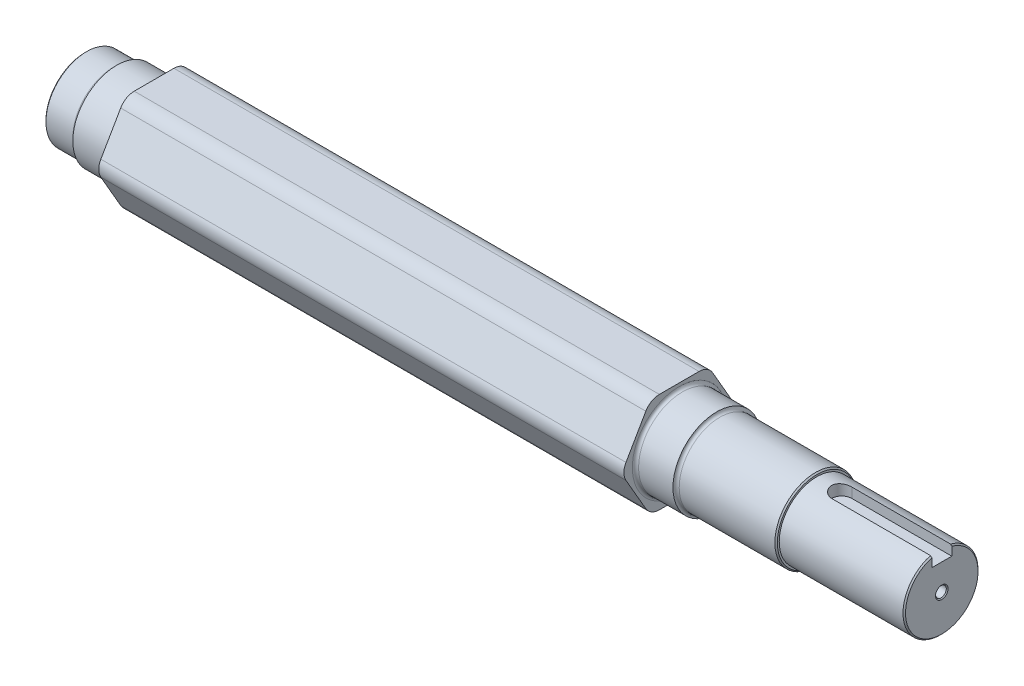
from build123d import *

# Parameters (mm, degrees)
BOSS_EXTRUDE3_DEPTH                    = 210
FILLET1_R                              = 2.5
FILLET2_R                              = 12.5
CHAMFER1_SIZE                          = 1
M10_TAPPED_HOLE1_D                     = 8.5
M10_TAPPED_HOLE1_DEPTH                 = 27.5
M10_TAPPED_HOLE1_CSINK_D               = 10.05
M10_TAPPED_HOLE1_CSINK_ANGLE           = 100
M10_TAPPED_HOLE1_TIP                   = 2.553657631
M10_TAPPED_HOLE1_ON_FACE_2_D           = 8.5
M10_TAPPED_HOLE1_ON_FACE_2_DEPTH       = 27.5
M10_TAPPED_HOLE1_ON_FACE_2_CSINK_D     = 10.05
M10_TAPPED_HOLE1_ON_FACE_2_CSINK_ANGLE = 100
M10_TAPPED_HOLE1_ON_FACE_2_TIP         = 2.553657631
CUT_EXTRUDE1_DEPTH                     = 9


with BuildPart() as part:
    # Sketch1 → Boss-Extrude3 (new, symmetric)
    with BuildSketch(Plane(origin=(0, 0, 0), x_dir=(0, 0, -1), z_dir=(1, 0, 0))):
        Polygon((23.094010768, -40), (46.188021535, 0), (23.094010768, 40), (-23.094010768, 40), (-46.188021535, 0), (-23.094010768, -40), align=None)
    extrude(amount=BOSS_EXTRUDE3_DEPTH, both=True)

    # Sketch3 → Revolve1 (revolve)
    with BuildSketch(Plane.XY, mode=Mode.PRIVATE) as revolve1_sk:
        Polygon((-210, 35), (-240, 35), (-240, 32.5), (-265, 32.5), (-265, 0), (-210, 0), align=None)
        Polygon((210, 35), (240, 35), (240, 32.5), (320, 32.5), (320, 30), (420, 30), (420, 0), (210, 0), align=None)
    revolve(revolve1_sk.sketch.rotate(Axis((-265, 0, 0), (1, 0, 0)), 90), axis=Axis((-265, 0, 0), (1, 0, 0)))

    # Fillet1
    fillet1_edges = [part.edges().sort_by_distance(p)[0] for p in [
        (-210, 0, -35),
        (-240, 0, -32.5),
        (210, 0, -35),
        (240, 0, -32.5),
    ]]
    fillet(fillet1_edges, radius=FILLET1_R - 0.0001)  # a hair under: the kernel refuses the full size

    # Fillet2
    fillet2_edges = [part.edges().sort_by_distance(p)[0] for p in [
        (0, -40, 23.094010768),
        (0, 0, 46.188021535),
        (0, 40, 23.094010768),
        (0, 40, -23.094010768),
        (0, 0, -46.188021535),
        (0, -40, -23.094010768),
    ]]
    fillet(fillet2_edges, radius=FILLET2_R)

    # Chamfer1
    chamfer1_edges = [part.edges().sort_by_distance(p)[0] for p in [
        (-265, 0, -32.5),
        (320, 0, -32.5),
        (420, 0, -30),
    ]]
    chamfer(chamfer1_edges, length=CHAMFER1_SIZE)

    # M10 Tapped Hole1
    with Locations(Plane(origin=(-265, 0, 0), x_dir=(0, 0, -1), z_dir=(-1, 0, 0))):
        with Locations((0, 0)):
            CounterSinkHole(M10_TAPPED_HOLE1_D / 2, M10_TAPPED_HOLE1_CSINK_D / 2, depth=M10_TAPPED_HOLE1_DEPTH, counter_sink_angle=M10_TAPPED_HOLE1_CSINK_ANGLE)
            with Locations((0, 0, -(M10_TAPPED_HOLE1_DEPTH + M10_TAPPED_HOLE1_TIP / 2))):  # 118° drill point
                Cone(0, M10_TAPPED_HOLE1_D / 2, M10_TAPPED_HOLE1_TIP, mode=Mode.SUBTRACT)

    # M10 Tapped Hole1 on face 2
    with Locations(Plane(origin=(420, 0, 0), x_dir=(0, 0, 1), z_dir=(1, 0, 0))):
        with Locations((0, 0)):
            CounterSinkHole(M10_TAPPED_HOLE1_ON_FACE_2_D / 2, M10_TAPPED_HOLE1_ON_FACE_2_CSINK_D / 2, depth=M10_TAPPED_HOLE1_ON_FACE_2_DEPTH, counter_sink_angle=M10_TAPPED_HOLE1_ON_FACE_2_CSINK_ANGLE)
            with Locations((0, 0, -(M10_TAPPED_HOLE1_ON_FACE_2_DEPTH + M10_TAPPED_HOLE1_ON_FACE_2_TIP / 2))):  # 118° drill point
                Cone(0, M10_TAPPED_HOLE1_ON_FACE_2_D / 2, M10_TAPPED_HOLE1_ON_FACE_2_TIP, mode=Mode.SUBTRACT)

    # Sketch7 → Cut-Extrude1 (cut)
    with BuildSketch(Plane(origin=(0, 30, 0), x_dir=(1, 0, 0), z_dir=(0, 1, 0))):
        with BuildLine():
            Line((420, -8), (340, -8))
            ThreePointArc((340, -8), (332, 0), (340, 8))
            Line((340, 8), (420, 8))
            ThreePointArc((420, 8), (428, 0), (420, -8))
        make_face()
    extrude(amount=-CUT_EXTRUDE1_DEPTH, mode=Mode.SUBTRACT)


solid = part.part
